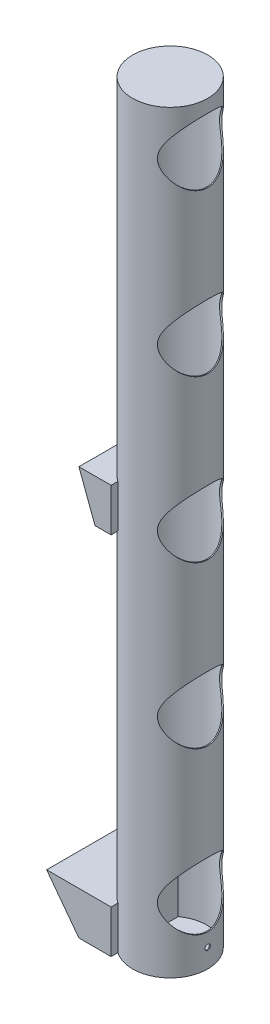
from build123d import *

# Parameters (mm, degrees)
SKETCH_2_R               = 35
SKETCH_2_R_2             = 34
EXTRUDE_1_DEPTH          = 700
EXTRUDE_START            = 1
SKETCH_3_R               = 35
EXTRUDE_2_DEPTH          = 1
SKETCH_4_R               = 35
EXTRUDE_3_DEPTH          = 1
SKETCH_5_R               = 2.5
SKETCH_5_R_2             = 30
CUT_EXTRUDE_1_DEPTH      = 703.745330828
SKETCH_6_R               = 10
CUT_EXTRUDE_2_DEPTH      = 703.745330937
EXTRUDE_START_2          = -20
SKETCH_7_W               = 70
SKETCH_7_H               = 40
EXTRUDE_4_DEPTH          = 60
EXTRUDE_START_3          = -50
SKETCH_8_W               = 70
SKETCH_8_H               = 40
EXTRUDE_5_DEPTH          = 30
CUT_EXTRUDE_3_DEPTH      = 707.417723551
CUT_EXTRUDE_3_DEPTH_BACK = 707.417723551


with BuildPart() as part:
    # Эскиз2 → Бобышка-Вытянуть1 (new body)
    with BuildSketch(Plane(origin=(0, 0, 0), x_dir=(1, 0, 0), z_dir=(0, 1, 0))):
        Circle(SKETCH_2_R)
        Circle(SKETCH_2_R_2, mode=Mode.SUBTRACT)
    extrude(amount=EXTRUDE_1_DEPTH)

    # Эскиз3 → Бобышка-Вытянуть2 (add)
    with BuildSketch(Plane.XZ.offset(EXTRUDE_START)):
        Circle(SKETCH_3_R)
    extrude(amount=-EXTRUDE_2_DEPTH)

    # Эскиз4 → Бобышка-Вытянуть3 (add)
    with BuildSketch(Plane(origin=(0, 700, 0), x_dir=(1, 0, 0), z_dir=(0, 1, 0))):
        Circle(SKETCH_4_R)
    extrude(amount=EXTRUDE_3_DEPTH)

    # Эскиз5 → Вырез-Вытянуть1 (cut, through all)
    with BuildSketch(Plane(origin=(0, 0, 0), x_dir=(0, 0, -1), z_dir=(1, 0, 0))):
        with Locations((0, 16.5)):
            Circle(SKETCH_5_R)
        with Locations((0, 59)):
            Circle(SKETCH_5_R_2)
        with Locations((0, 209)):
            Circle(SKETCH_5_R_2)
        with Locations((0, 359)):
            Circle(SKETCH_5_R_2)
        with Locations((0, 509)):
            Circle(SKETCH_5_R_2)
        with Locations((0, 659)):
            Circle(SKETCH_5_R_2)
    extrude(amount=CUT_EXTRUDE_1_DEPTH, mode=Mode.SUBTRACT)

    # Эскиз6 → Вырез-Вытянуть2 (cut, through all)
    with BuildSketch(Plane(origin=(0, 0, 0), x_dir=(0, 0, -1), z_dir=(1, 0, 0))):
        with Locations((0, 686)):
            Circle(SKETCH_6_R)
    extrude(amount=-CUT_EXTRUDE_2_DEPTH, mode=Mode.SUBTRACT)

    # Эскиз7 → Бобышка-Вытянуть4 (add)
    with BuildSketch(Plane(origin=(0, 0, 0), x_dir=(0, 0, -1), z_dir=(1, 0, 0)).offset(EXTRUDE_START_2)):
        with Locations((0, 19)):
            Rectangle(SKETCH_7_W, SKETCH_7_H)
    extrude(amount=-EXTRUDE_4_DEPTH)

    # Эскиз8 → Бобышка-Вытянуть5 (add)
    with BuildSketch(Plane(origin=(0, 0, 0), x_dir=(0, 0, -1), z_dir=(1, 0, 0)).offset(EXTRUDE_START_3)):
        with Locations((0, 359)):
            Rectangle(SKETCH_8_W, SKETCH_8_H)
    extrude(amount=EXTRUDE_5_DEPTH)

    # Эскиз9 → Вырез-Вытянуть3 (cut, two sides: drawn at the far end of the back side and taken through both)
    with BuildSketch(Plane.XY.offset(-CUT_EXTRUDE_3_DEPTH_BACK)):
        Polygon((-50, -1), (-80, 39), (-80, -1), align=None)
        Polygon((-35, 339), (-50, 379), (-50, 339), align=None)
    extrude(amount=CUT_EXTRUDE_3_DEPTH + CUT_EXTRUDE_3_DEPTH_BACK, mode=Mode.SUBTRACT)


solid = part.part
